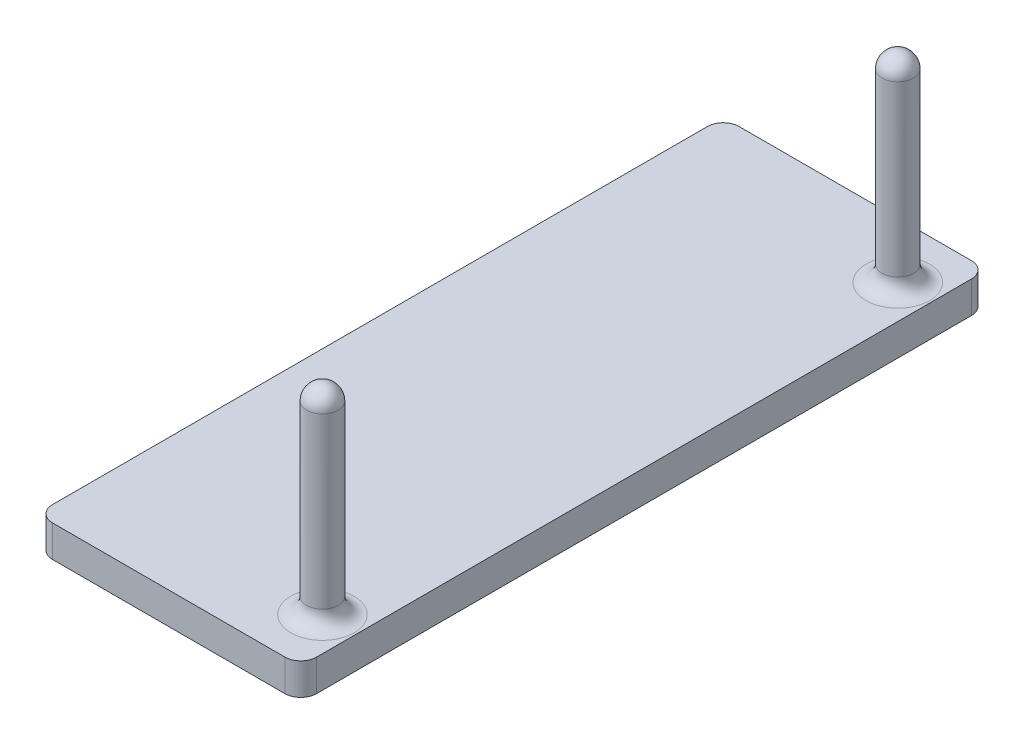
from build123d import *

# Parameters (mm, degrees)
SKETCH1_W           = 25
SKETCH1_H           = 65
BOSS_EXTRUDE1_DEPTH = 3
SKETCH2_R           = 1.5
BOSS_EXTRUDE2_DEPTH = 19
FILLET1_R           = 1.5


with BuildPart() as part:
    # Sketch1 → Boss-Extrude1 (new body)
    with BuildSketch(Plane(origin=(0, 0, 0), x_dir=(1, 0, 0), z_dir=(0, 1, 0))):
        Rectangle(SKETCH1_W, SKETCH1_H)
    extrude(amount=BOSS_EXTRUDE1_DEPTH)

    # Sketch2 → Boss-Extrude2 (add)
    with BuildSketch(Plane(origin=(0, 3, 0), x_dir=(1, 0, 0), z_dir=(0, 1, 0))):
        with Locations((9.289666573, 27.234893969)):
            Circle(SKETCH2_R)
        with Locations((9.289666573, -27.234893969)):
            Circle(SKETCH2_R)
    extrude(amount=BOSS_EXTRUDE2_DEPTH)

    # Fillet1
    fillet1_edges = [part.edges().sort_by_distance(p)[0] for p in [
        (7.789666573, 3, -27.234893969),
        (7.789666573, 3, 27.234893969),
        (12.5, 1.5, 32.5),
        (-12.5, 1.5, -32.5),
        (12.5, 1.5, -32.5),
        (-12.5, 1.5, 32.5),
        (7.789666573, 22, 27.234893969),
        (7.789666573, 22, -27.234893969),
    ]]
    fillet(fillet1_edges, radius=FILLET1_R)


solid = part.part
